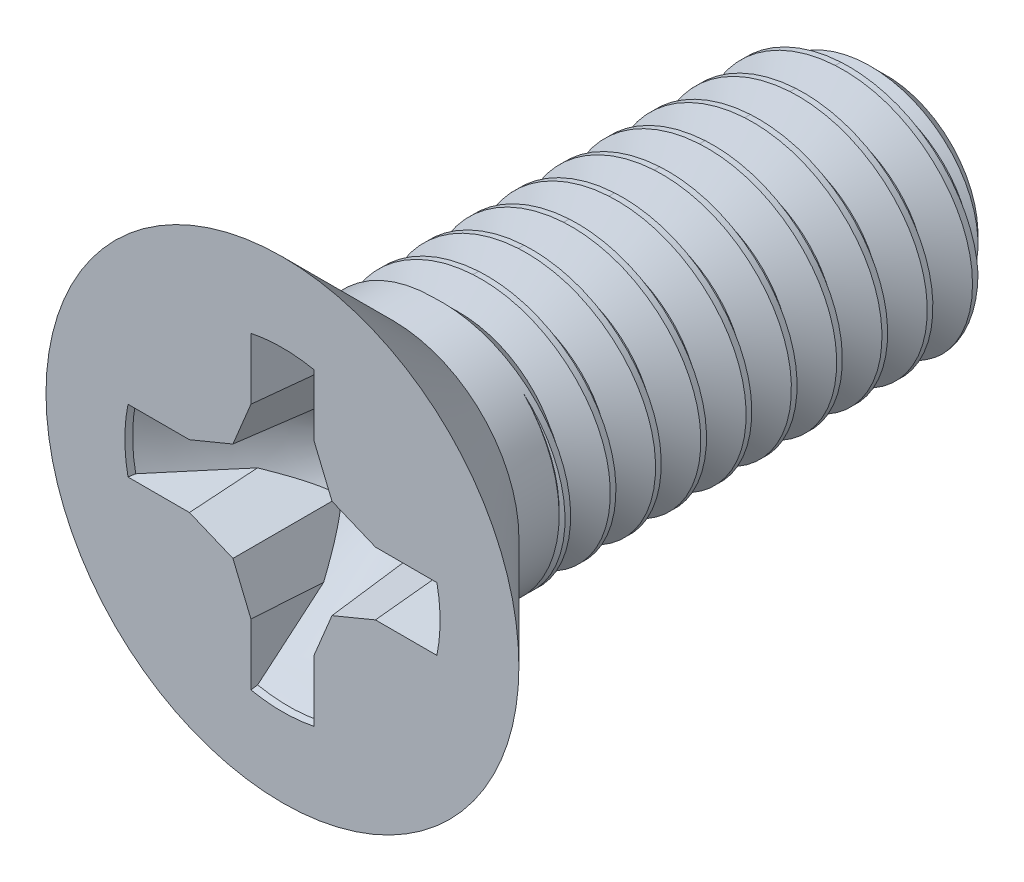
from build123d import *

# Parameters (mm, degrees)
SKETCH1_R          = 2.35
EXTRUDE3_DEPTH     = 1.5
SKETCH4_W          = 6
SKETCH4_H          = 1.25
CUT_SWEEP1_PITCH   = 0.45
SKETCH26_R         = 0.625
EXTRUDE8_DEPTH     = 1.5
CUT_EXTRUDE3_REACH = 8.859
CIRPATTERN1_COUNT  = 4
DRAFT2_ANGLE       = 5


with BuildPart() as part:
    # Sketch1 → Extrude3 (new body)
    with BuildSketch(Plane.XY):
        Circle(SKETCH1_R)
    extrude(amount=EXTRUDE3_DEPTH)

    # Sketch11 → Cut-Revolve3 (revolve, cut)
    with BuildSketch(Plane(origin=(0, 0, 0), x_dir=(0, 0, -1), z_dir=(1, 0, 0)), mode=Mode.PRIVATE) as cut_revolve3_sk:
        Polygon((0, 0.85), (-1.5, 2.35), (0, 2.35), align=None)
    revolve(cut_revolve3_sk.sketch.rotate(Axis((0, 0, -0.441444004), (0, 0, 1)), 90), axis=Axis((0, 0, -0.441444004), (0, 0, 1)), mode=Mode.SUBTRACT)

    # Extrude10: read off the stored shape, not the designer's step
    # Extrude10 outline → Extrude10 (revolve)
    with BuildSketch(Plane.XZ):
        Polygon((1.25, 0), (1.25, 0.4), (0.85, 0.4), (0.85, 0), (0, 0), (0, -1.25), align=None)
    revolve(axis=Axis((0, 0, 0), (0, 0, 1)))



with BuildPart() as body_2:
    # Sketch4 → Revolve1 (revolve)
    with BuildSketch(Plane(origin=(0, 0, 0), x_dir=(0, 0, -1), z_dir=(1, 0, 0)), mode=Mode.PRIVATE) as revolve1_sk:
        with Locations((1.5, 0.625)):
            Rectangle(SKETCH4_W, SKETCH4_H)
    revolve(revolve1_sk.sketch.rotate(Axis((0, 0, 1.5), (0, 0, -1)), 180), axis=Axis((0, 0, 1.5), (0, 0, -1)))

    # Cut-Sweep1: arcs per turn and ends read off the stored shape
    # Cut-Sweep1: the profile of Sketch14 profile screwed along a right-hand helix through 13.333333 turns, 6 arcs to a turn; built about Z, then put on its axis
    cut_sweep1_z = Axis((0, 0, 0), (0, 0, 1))
    cut_sweep1_corners = [(1.2503, 1.309e-06, -0.337333632), (1.2503, 1.309e-06, -0.731416218), (0.945566941, 9.9e-07, -0.562499925), (0.945566941, 9.9e-07, -0.506249925)]
    with BuildLine(mode=Mode.PRIVATE) as cut_sweep1_profile:
        Line(cut_sweep1_corners[0], cut_sweep1_corners[1])
        Line(cut_sweep1_corners[1], cut_sweep1_corners[2])
        Line(cut_sweep1_corners[2], cut_sweep1_corners[3])
        Line(cut_sweep1_corners[3], cut_sweep1_corners[0])
    cut_sweep1_cap = Face(cut_sweep1_profile.wire())
    cut_sweep1_turn_angles = [0, 30, 60, 90, 120, 150, 180, 210, 240, 270, 300, 330, 360]
    cut_sweep1_turn_weights = [1, 0.8660254037844387, 1, 0.8660254037844387, 1, 0.8660254037844387, 1, 0.8660254037844387, 1, 0.8660254037844387, 1, 0.8660254037844387, 1]
    cut_sweep1_turn_rails = [Edge.make_bspline([Vector(p[0], p[1], 0).rotate(cut_sweep1_z, cut_sweep1_turn_angles[k]) / cut_sweep1_turn_weights[k] + Vector(0, 0, p[2] + CUT_SWEEP1_PITCH * cut_sweep1_turn_angles[k] / 360) for k in range(13)], [0, 0, 0, 1, 1, 2, 2, 3, 3, 4, 4, 5, 5, 6, 6, 6], 2, cut_sweep1_turn_weights) for p in cut_sweep1_corners]
    cut_sweep1_turn_sides = [Face.make_surface_from_curves(cut_sweep1_turn_rails[p[0]], cut_sweep1_turn_rails[p[1]]) for p in [(0, 1), (1, 2), (2, 3), (3, 0)]]
    cut_sweep1_last_angles = [4680, 4710, 4740, 4770, 4800]
    cut_sweep1_last_weights = [1, 0.8660254037844387, 1, 0.8660254037844902, 1]
    cut_sweep1_last_rails = [Edge.make_bspline([Vector(p[0], p[1], 0).rotate(cut_sweep1_z, cut_sweep1_last_angles[k]) / cut_sweep1_last_weights[k] + Vector(0, 0, p[2] + CUT_SWEEP1_PITCH * cut_sweep1_last_angles[k] / 360) for k in range(5)], [0, 0, 0, 1, 1, 2, 2, 2], 2, cut_sweep1_last_weights) for p in cut_sweep1_corners]
    cut_sweep1_last_sides = [Face.make_surface_from_curves(cut_sweep1_last_rails[p[0]], cut_sweep1_last_rails[p[1]]) for p in [(0, 1), (1, 2), (2, 3), (3, 0)]]
    cut_sweep1 = Plane(origin=(0, 0, -4.5), x_dir=(-1, 0, 0), z_dir=(0, 0, 1)) * Solid(Shell([*[p.moved(Location((0, 0, CUT_SWEEP1_PITCH * i))) for i in range(13) for p in cut_sweep1_turn_sides], *cut_sweep1_last_sides, cut_sweep1_cap, cut_sweep1_cap.rotate(cut_sweep1_z, 4800).moved(Location((0, 0, CUT_SWEEP1_PITCH * 4800 / 360)))]))
    add(cut_sweep1, mode=Mode.SUBTRACT)

    # Sketch19 → Cut-Revolve4 (revolve, cut)
    with BuildSketch(Plane(origin=(0, 0, 0), x_dir=(0, 0, -1), z_dir=(1, 0, 0)), mode=Mode.PRIVATE) as cut_revolve4_sk:
        Polygon((4.5, 1.25), (4.1625, 1.25), (4.5, 0.9125), align=None)
    revolve(cut_revolve4_sk.sketch.rotate(Axis((0, 0, 1.5), (0, 0, -1)), 180), axis=Axis((0, 0, 1.5), (0, 0, -1)), mode=Mode.SUBTRACT)


with BuildPart() as part_1:
    add(part.part)

    add(body_2.part)  # Extrude8 merges body 2
    # Sketch26 → Extrude8 (add)
    with BuildSketch(Plane.XY.offset(1.5)):
        Circle(SKETCH26_R)
    extrude(amount=-EXTRUDE8_DEPTH)

    # Cut-Extrude3: up to this cone (the profile starts inside it)
    cut_extrude3_end = Plane(origin=(0, 0, 1.5), z_dir=(0, 0, 1)).offset(-1.611465251) * Cone(1e-06, 12.581932502, 12.581931502, align=(Align.CENTER, Align.CENTER, Align.MIN), mode=Mode.PRIVATE)
    # Sketch12 → Cut-Extrude3 (cut, up to the surface)
    with BuildSketch(Plane.XY.offset(1.5), mode=Mode.PRIVATE) as cut_extrude3_sk1:
        with BuildLine():
            Line((1.535013572, 0.313333333), (0.924173453, 0.313333333))
            Line((0.924173453, 0.313333333), (0.492244262, 0.492244262))
            Line((0.492244262, 0.492244262), (0.313333333, 0.924173453))
            Line((0.313333333, 0.924173453), (0.313333333, 1.535013572))
            ThreePointArc((0.313333333, 1.535013572), (0.15746404, 1.558733306), (0, 1.566666667))
            Line((0, 1.566666667), (0, 0))
            Line((0, 0), (1.566666667, 0))
            ThreePointArc((1.566666667, 0), (1.558733306, 0.15746404), (1.535013572, 0.313333333))
        make_face()
    cut_extrude3_tool1 = extrude(cut_extrude3_sk1.sketch, amount=-CUT_EXTRUDE3_REACH, mode=Mode.PRIVATE) & cut_extrude3_end
    cut_extrude3 = cut_extrude3_tool1.solids().sort_by_distance((1.229594, 0.291177, 1.5))[0]
    add(cut_extrude3, mode=Mode.SUBTRACT)

    # CirPattern1: Cut-Extrude3 ×4 about axis
    cirpattern1_axis = Axis((0, 0, 0), (0, 0, 1))
    for i in range(1, CIRPATTERN1_COUNT):
        add(cut_extrude3.rotate(cirpattern1_axis, i * 360 / CIRPATTERN1_COUNT), mode=Mode.SUBTRACT)

    # Draft1: read off the stored shape, not the designer's step
    # Draft1 outline → Draft1 (revolve)
    with BuildSketch(Plane.XZ):
        Polygon((1.566666667, 1.5), (1.550268881, 1.43880263), (1.566666667, 1.43880263), align=None)
    revolve(axis=Axis((0, 0, 0), (0, 0, 1)))

    # Draft2
    draft2_faces = [part_1.faces().sort_by_distance(p)[0] for p in [
        (0.313333333, 1.140840621, 1.286158691),
        (0.408124508, 0.695327313, 1.100915441),
        (0.695327313, 0.408124508, 1.100915441),
        (1.140840621, 0.313333333, 1.286158691),
        (1.140840621, -0.313333333, 1.286158691),
        (0.695327313, -0.408124508, 1.100915441),
        (0.408124508, -0.695327313, 1.100915441),
        (0.313333333, -1.140840621, 1.286158691),
        (-0.313333333, -1.140840621, 1.286158691),
        (-0.408124508, -0.695327313, 1.100915441),
        (-0.695327313, -0.408124508, 1.100915441),
        (-1.140840621, -0.313333333, 1.286158691),
        (-1.140840621, 0.313333333, 1.286158691),
        (-0.695327313, 0.408124508, 1.100915441),
        (-0.408124508, 0.695327313, 1.100915441),
        (-0.313333333, 1.140840621, 1.286158691),
    ]]
    draft(draft2_faces, Plane.XY.offset(1.5), DRAFT2_ANGLE)


solid = part_1.part
